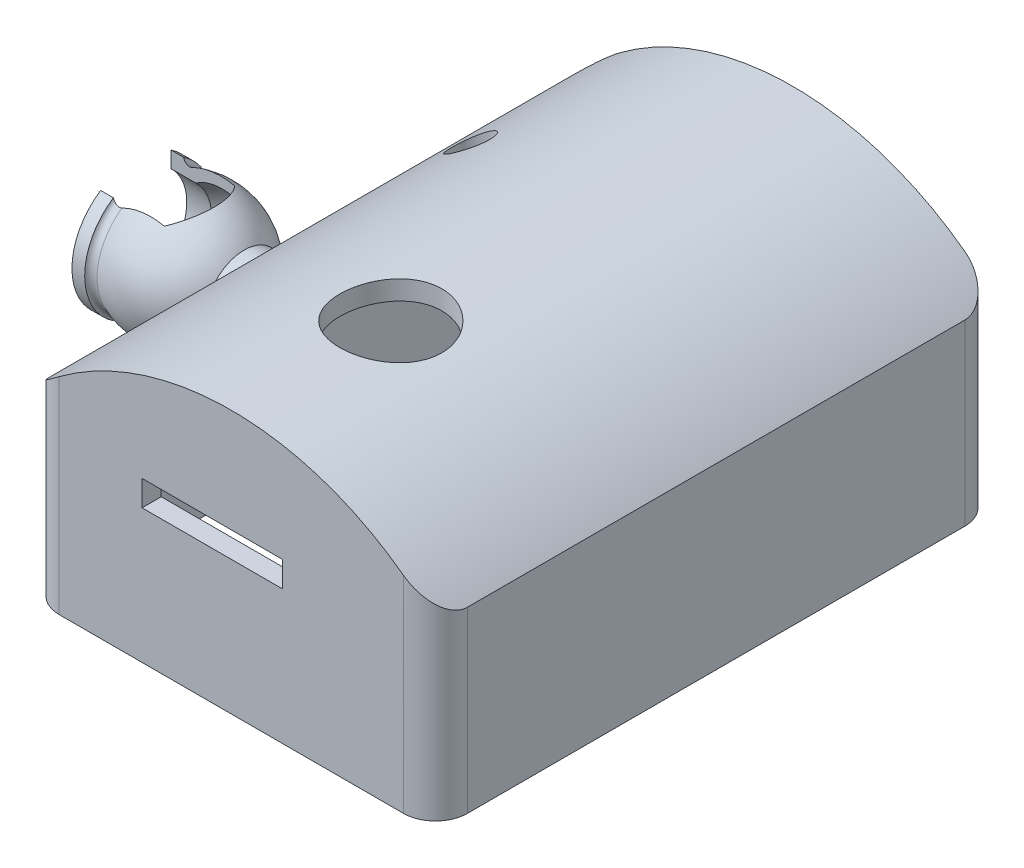
from build123d import *

# Parameters (mm, degrees)
BOSS_EXTRUDE1_DEPTH      = 44
SHELL1_T                 = -1.5
SKETCH4_R                = 4
CUT_EXTRUDE1_DEPTH       = 44
BOSS_EXTRUDE2_REACH      = 50.21
BOSS_EXTRUDE2_END_RADIUS = 21.127416998
SKETCH6_W                = 28.5
SKETCH6_H                = 4
SKETCH6_W_2              = 5.75
SKETCH6_H_2              = 3
SKETCH7_W                = 11
SKETCH7_H                = 2
CUT_EXTRUDE2_DEPTH       = 20
BOSS_EXTRUDE3_REACH      = 50.21
BOSS_EXTRUDE3_END_RADIUS = 21.127416998
SKETCH8_R                = 2.5
SKETCH9_R                = 1.5
CUT_EXTRUDE3_DEPTH       = 20
SKETCH10_R               = 3
BOSS_EXTRUDE4_DEPTH      = 5
CUT_EXTRUDE4_DEPTH       = 10
CUT_EXTRUDE4_DEPTH_BACK  = 10
SKETCH13_R               = 4
CUT_EXTRUDE5_DEPTH       = 2
FILLET1_R                = 0.5
FILLET2_R                = 2.5


with BuildPart() as part:
    # Sketch1 → Boss-Extrude1 (new body)
    with BuildSketch(Plane.XY):
        with BuildLine():
            Line((-16, -7), (16, -7))
            Line((16, -7), (16, 7))
            ThreePointArc((16, 7), (0, 13.627416998), (-16, 7))
            Line((-16, 7), (-16, -7))
        make_face()
    extrude(amount=BOSS_EXTRUDE1_DEPTH)

    # Shell1
    shell1_openings = [part.faces().sort_by_distance(p)[0] for p in [
        (0, -7, 22),
    ]]
    offset(amount=SHELL1_T, openings=shell1_openings, kind=Kind.INTERSECTION)

    # Sketch4 → Cut-Extrude1 (cut)
    with BuildSketch(Plane(origin=(0, 18, 0), x_dir=(-1, 0, 0), z_dir=(0, -1, 0))):
        with Locations(Location((0, -31.5, 0), (0, 0, 270))):
            Circle(SKETCH4_R)
    extrude(amount=CUT_EXTRUDE1_DEPTH, mode=Mode.SUBTRACT)

    # Boss-Extrude2: up to this cylinder (the profile starts inside it)
    boss_extrude2_end = Plane(origin=(0, -9, 22.25), z_dir=(0, 0, -1)) * Cylinder(BOSS_EXTRUDE2_END_RADIUS, 181.174833996, mode=Mode.PRIVATE)
    # Sketch6 → Boss-Extrude2 (add, up to the surface)
    with BuildSketch(Plane(origin=(0, 4.5, 0), x_dir=(-1, 0, 0), z_dir=(0, -1, 0)), mode=Mode.PRIVATE) as boss_extrude2_sk1:
        with Locations((0, -3.5)):
            Rectangle(SKETCH6_W, SKETCH6_H)
    boss_extrude2_tool1 = extrude(boss_extrude2_sk1.sketch, amount=-BOSS_EXTRUDE2_REACH, mode=Mode.PRIVATE) & boss_extrude2_end
    add(boss_extrude2_tool1.solids().sort_by_distance((0, 4.5, 3.5))[0])
    # Sketch6 → Boss-Extrude2 (add, up to the surface)
    with BuildSketch(Plane(origin=(0, 4.5, 0), x_dir=(-1, 0, 0), z_dir=(0, -1, 0)), mode=Mode.PRIVATE) as boss_extrude2_sk2:
        with Locations((-11.375, -41)):
            Rectangle(SKETCH6_W_2, SKETCH6_H_2)
    boss_extrude2_tool2 = extrude(boss_extrude2_sk2.sketch, amount=-BOSS_EXTRUDE2_REACH, mode=Mode.PRIVATE) & boss_extrude2_end
    add(boss_extrude2_tool2.solids().sort_by_distance((11.375, 4.5, 41))[0])
    # Sketch6 → Boss-Extrude2 (add, up to the surface)
    with BuildSketch(Plane(origin=(0, 4.5, 0), x_dir=(-1, 0, 0), z_dir=(0, -1, 0)), mode=Mode.PRIVATE) as boss_extrude2_sk3:
        with Locations((11.375, -41)):
            Rectangle(SKETCH6_W_2, SKETCH6_H_2)
    boss_extrude2_tool3 = extrude(boss_extrude2_sk3.sketch, amount=-BOSS_EXTRUDE2_REACH, mode=Mode.PRIVATE) & boss_extrude2_end
    add(boss_extrude2_tool3.solids().sort_by_distance((-11.375, 4.5, 41))[0])

    # Sketch7 → Cut-Extrude2 (cut)
    with BuildSketch(Plane.XY.offset(44)):
        with Locations((-1.5, 4.5)):
            Rectangle(SKETCH7_W, SKETCH7_H)
    extrude(amount=-CUT_EXTRUDE2_DEPTH, mode=Mode.SUBTRACT)

    # Boss-Extrude3: up to this cylinder (the profile starts inside it)
    boss_extrude3_end = Plane(origin=(0, -9, 12.5), z_dir=(0, 0, -1)) * Cylinder(BOSS_EXTRUDE3_END_RADIUS, 143.674833996, mode=Mode.PRIVATE)
    # Sketch8 → Boss-Extrude3 (add, up to the surface)
    with BuildSketch(Plane(origin=(0, 4.5, 0), x_dir=(-1, 0, 0), z_dir=(0, -1, 0)), mode=Mode.PRIVATE) as boss_extrude3_sk1:
        with Locations((12.75, -12.5)):
            Circle(SKETCH8_R)
    boss_extrude3_tool1 = extrude(boss_extrude3_sk1.sketch, amount=-BOSS_EXTRUDE3_REACH, mode=Mode.PRIVATE) & boss_extrude3_end
    add(boss_extrude3_tool1.solids().sort_by_distance((-12.75, 4.5, 12.5))[0])

    # Sketch9 → Cut-Extrude3 (cut)
    with BuildSketch(Plane(origin=(0, 4.5, 0), x_dir=(-1, 0, 0), z_dir=(0, -1, 0))):
        with Locations(Location((12.75, -12.5, 0), (0, 0, 90))):
            Circle(SKETCH9_R)
    extrude(amount=-CUT_EXTRUDE3_DEPTH, mode=Mode.SUBTRACT)

    # Sketch10 → Boss-Extrude4 (add)
    with BuildSketch(Plane.ZY.offset(16)):
        with Locations(Location((22, 0, 0), (0, 0, 180))):
            Circle(SKETCH10_R)
    extrude(amount=BOSS_EXTRUDE4_DEPTH)

    # Sketch11 → Revolve1 (revolve)
    with BuildSketch(Plane(origin=(0, 0, 0), x_dir=(1, 0, 0), z_dir=(0, 1, 0)), mode=Mode.PRIVATE) as revolve1_sk:
        with BuildLine():
            Line((-28.75, -25.125), (-28.75, -24.5))
            Line((-28.75, -24.5), (-29.5, -24.5))
            Line((-29.5, -24.5), (-29.5, -27))
            Line((-29.5, -27), (-28.5, -27))
            Line((-28.5, -27), (-28.5, -26.375))
            ThreePointArc((-28.5, -26.375), (-24.498826461, -27.057537487), (-21, -25))
            Line((-21, -25), (-21, -23))
            ThreePointArc((-21, -23), (-24.254299287, -26.326232014), (-28.75, -25.125))
        make_face()
    revolve(revolve1_sk.sketch.rotate(Axis((-21, 0, 22), (-1, 0, 0)), 180), axis=Axis((-21, 0, 22), (-1, 0, 0)))

    # Sketch12 → Cut-Extrude4 (cut, two sides: drawn at the far end of the back side and taken through both)
    with BuildSketch(Plane(origin=(0, 0, 0), x_dir=(1, 0, 0), z_dir=(0, 1, 0)).offset(-CUT_EXTRUDE4_DEPTH_BACK)):
        with BuildLine():
            Line((-29.5, -19.25), (-29.5, -24.75))
            Line((-29.5, -24.75), (-24.5, -24.75))
            ThreePointArc((-24.5, -24.75), (-23.360912703, -22), (-24.5, -19.25))
            Line((-24.5, -19.25), (-29.5, -19.25))
        make_face()
    extrude(amount=CUT_EXTRUDE4_DEPTH + CUT_EXTRUDE4_DEPTH_BACK, mode=Mode.SUBTRACT)

    # Sketch13 → Cut-Extrude5 (cut)
    with BuildSketch(Plane.ZY.offset(29.5)):
        with Locations((22, 0)):
            Circle(SKETCH13_R)
    extrude(amount=-CUT_EXTRUDE5_DEPTH, mode=Mode.SUBTRACT)

    # Fillet1
    # the kernel refuses this fillet: 0.5 mm, written as the material it adds along each edge
    with BuildSketch(Plane(origin=(-28.5, 0, 22), x_dir=(0, 0, -1), z_dir=(0, 1, 0))) as fillet1_piece_1_section:
        with BuildLine():
            CenterArc((5.163142561, -0.4726357), FILLET1_R, 109.043451943, 93.528829038)
            Line((5, 0), (4.996737149, 0.009452714))
            ThreePointArc((4.996737149, 0.009452714), (4.6875, 0.01), (4.375, 0.01))
            Line((4.375, 0.01), (4.366318014, -0.004962168))
            ThreePointArc((4.366318014, -0.004962168), (4.539656712, -0.331575386), (4.692210588, -0.668398506))
            Line((4.692210588, -0.668398506), (4.701444548, -0.66456002))
        make_face()
    fillet1_piece_1 = revolve(axis=Axis((-28.5, 0, 22), (-1, 0, 0)), revolution_arc=75.299662724, mode=Mode.PRIVATE)
    fillet1_piece_1 = split(fillet1_piece_1, bisect_by=Plane(origin=(-28.33723458, -2.015540389, 19.25), z_dir=(0, 0, -1)), keep=Keep.TOP, mode=Mode.PRIVATE)
    add(fillet1_piece_1)
    with BuildSketch(Plane(origin=(-28.5, 0, 22), x_dir=(0, -0.9673078911177772, 0.2536048969978272), z_dir=(0, -0.2536048969978272, -0.9673078911177772))) as fillet1_piece_2_section:
        with BuildLine():
            CenterArc((5.163142561, -0.4726357), FILLET1_R, 109.043451943, 93.528829038)
            Line((5, 0), (4.996737149, 0.009452714))
            ThreePointArc((4.996737149, 0.009452714), (4.6875, 0.01), (4.375, 0.01))
            Line((4.375, 0.01), (4.366318014, -0.004962168))
            ThreePointArc((4.366318014, -0.004962168), (4.539656712, -0.331575386), (4.692210588, -0.668398506))
            Line((4.692210588, -0.668398506), (4.701444548, -0.66456002))
        make_face()
    fillet1_piece_2 = revolve(axis=Axis((-28.5, 0, 22), (-1, 0, 0)), revolution_arc=150.618131068, mode=Mode.PRIVATE)
    fillet1_piece_2 = split(fillet1_piece_2, bisect_by=Plane(origin=(-28.236593928, 0, 24.75), z_dir=(0, 0, 1)), keep=Keep.TOP, mode=Mode.PRIVATE)
    add(fillet1_piece_2)
    with BuildSketch(Plane(origin=(-28.5, 0, 22), x_dir=(0, 0.9672662589950115, -0.25376363847051725), z_dir=(0, 0.25376363847051725, 0.9672662589950115))) as fillet1_piece_3_section:
        with BuildLine():
            CenterArc((5.163142561, -0.4726357), FILLET1_R, 109.043451943, 93.528829038)
            Line((5, 0), (4.996737149, 0.009452714))
            ThreePointArc((4.996737149, 0.009452714), (4.6875, 0.01), (4.375, 0.01))
            Line((4.375, 0.01), (4.366318014, -0.004962168))
            ThreePointArc((4.366318014, -0.004962168), (4.539656712, -0.331575386), (4.692210588, -0.668398506))
            Line((4.692210588, -0.668398506), (4.701444548, -0.66456002))
        make_face()
    fillet1_piece_3 = revolve(axis=Axis((-28.5, 0, 22), (-1, 0, 0)), revolution_arc=75.299662724, mode=Mode.PRIVATE)
    fillet1_piece_3 = split(fillet1_piece_3, bisect_by=Plane(origin=(-28.337234467, 2.015540468, 19.25), z_dir=(0, 0, -1)), keep=Keep.TOP, mode=Mode.PRIVATE)
    add(fillet1_piece_3)

    # Fillet2
    fillet2_edges = [part.edges().sort_by_distance(p)[0] for p in [
        (14.5, -0.316938289, 42.5),
        (-14.5, -0.316938289, 42.5),
        (-14.5, -0.316938289, 1.5),
        (14.5, -0.316938289, 1.5),
        (16, 0, 0),
        (16, 0, 44),
        (-16, 0, 44),
        (-16, 0, 0),
    ]]
    fillet(fillet2_edges, radius=FILLET2_R)


solid = part.part
